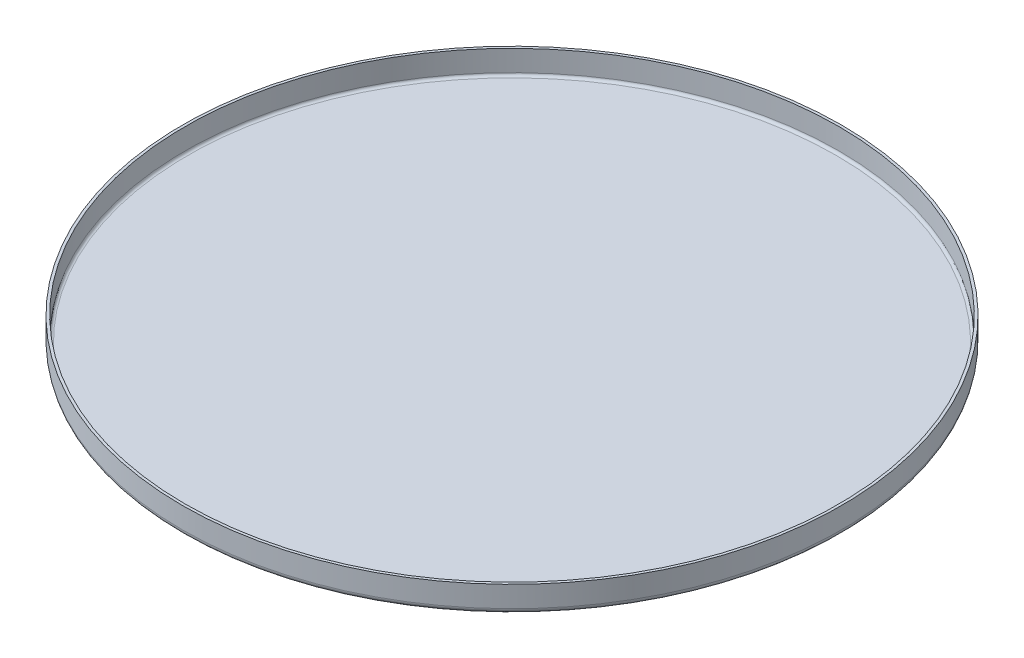
from build123d import *

# Parameters (mm, degrees)
SKETCH1_R          = 3.175
BASE_FLANGE1_DEPTH = 0.0254


# Read off the part's stored shape, not the designer's step: Edge-Flange1
# Sheet-metal steps are written as plain solids
with BuildPart() as part:
    # Sketch1 → Base-Flange1 (new body)
    with BuildSketch(Plane(origin=(0, 0, 0), x_dir=(1, 0, 0), z_dir=(0, 1, 0))):
        with Locations(Location((0, 0, 0), (0, 0, 270))):
            Circle(SKETCH1_R)
    extrude(amount=-BASE_FLANGE1_DEPTH)

    # Edge-Flange1 outline → Edge-Flange1 (revolve, cut)
    with BuildSketch(Plane.XY):
        with BuildLine():
            Line((3.175, 0), (3.16819409, 0))
            ThreePointArc((3.16819409, 0), (3.149599999, -0.01859409), (3.1242, -0.0254))
            Line((3.1242, -0.0254), (3.175, -0.0254))
            Line((3.175, -0.0254), (3.175, 0))
        make_face()
    revolve(axis=Axis((0, 0, 0), (0, 1, 0)), mode=Mode.SUBTRACT)

    # Edge-Flange1 2 outline → Edge-Flange1 2 (revolve)
    with BuildSketch(Plane.XY):
        with BuildLine():
            Line((3.175, 0.2286), (3.1496, 0.2286))
            Line((3.1496, 0.2286), (3.1496, 0.0254))
            ThreePointArc((3.1496, 0.0254), (3.142160512, 0.007439488), (3.1242, 0))
            Line((3.1242, 0), (3.16819409, 0))
            ThreePointArc((3.16819409, 0), (3.173269032, 0.012251992), (3.175, 0.0254))
            Line((3.175, 0.0254), (3.175, 0.2286))
        make_face()
    revolve(axis=Axis((0, 0, 0), (0, 1, 0)))


solid = part.part
